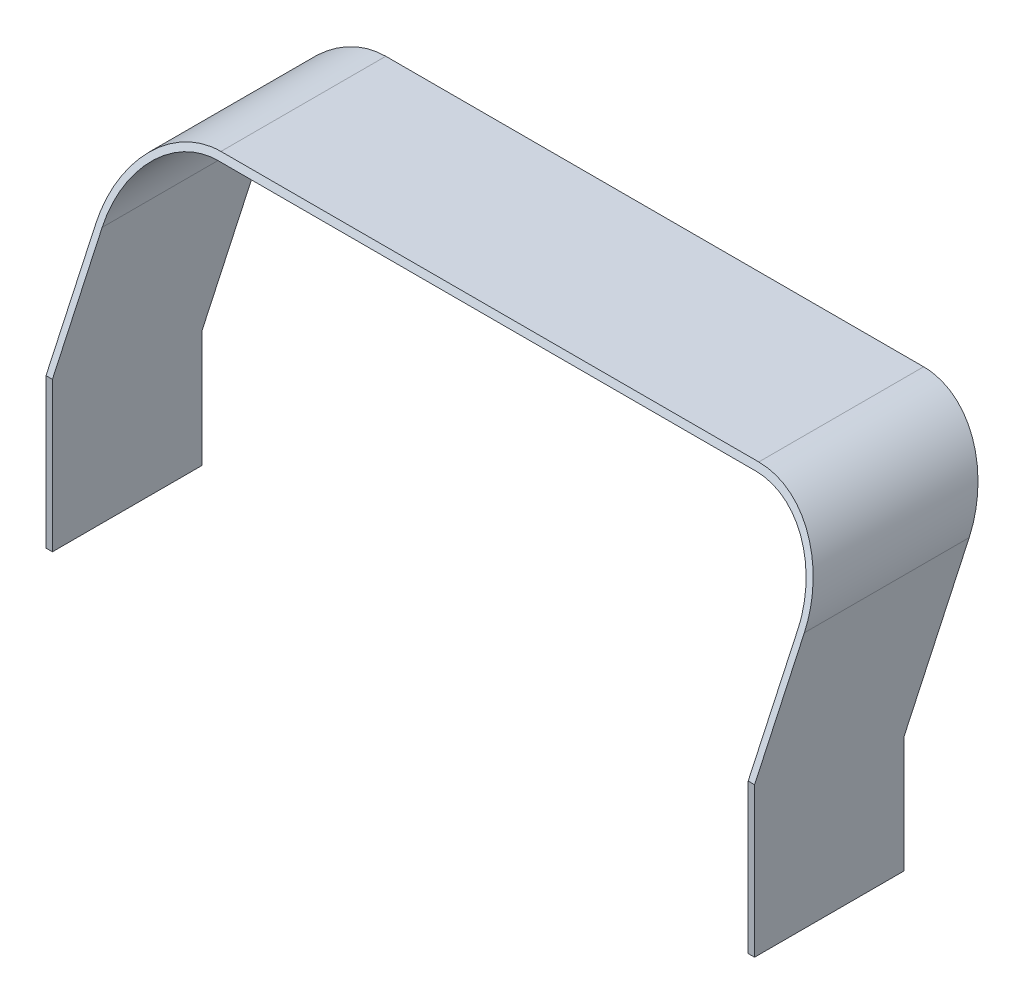
from build123d import *

# Parameters (mm, degrees)
BOSS_EXTRUDE1_DEPTH = 70
CUT_EXTRUDE1_DEPTH  = 200.200903612


with BuildPart() as part:
    # Sketch1 → Boss-Extrude1 (new body)
    with BuildSketch(Plane.XY):
        with BuildLine():
            Line((-83, 5), (-83, 65))
            ThreePointArc((-83, 65), (-77.142135624, 79.142135624), (-63, 85))
            Line((-63, 85), (63, 85))
            ThreePointArc((63, 85), (77.142135624, 79.142135624), (83, 65))
            Line((83, 65), (83, 5))
            Line((83, 5), (81.5, 5))
            Line((81.5, 5), (81.5, 65))
            ThreePointArc((81.5, 65), (76.081475452, 78.081475452), (63, 83.5))
            Line((63, 83.5), (-63, 83.5))
            ThreePointArc((-63, 83.5), (-76.081475452, 78.081475452), (-81.5, 65))
            Line((-81.5, 65), (-81.5, 5))
            Line((-81.5, 5), (-83, 5))
        make_face()
    extrude(amount=BOSS_EXTRUDE1_DEPTH)

    # Sketch2 → Cut-Extrude1 (cut, through all)
    with BuildSketch(Plane.ZY.offset(83)):
        Polygon((49.016155383, 85), (70, 40), (70, 85), align=None)
        Polygon((10.397928219, 85), (35, 32.240686807), (35, 4.870884332), (0, 4.870884332), (0, 85), align=None)
    extrude(amount=-CUT_EXTRUDE1_DEPTH, mode=Mode.SUBTRACT)


solid = part.part
